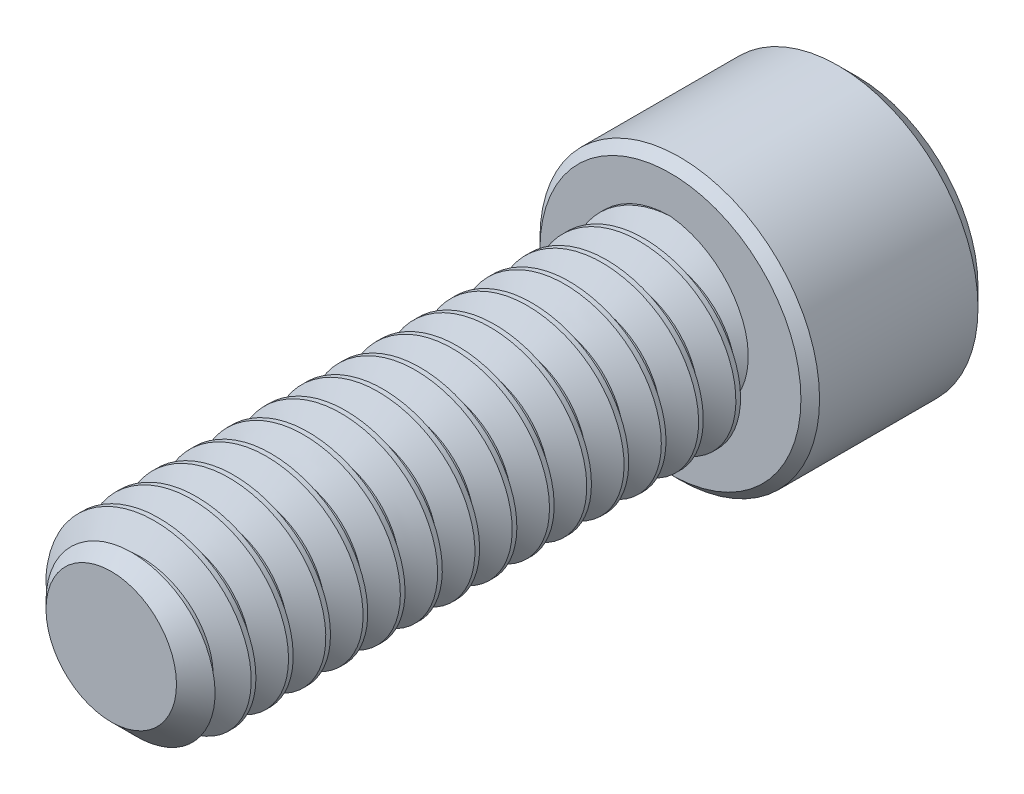
from build123d import *

# Parameters (mm, degrees)
SKETCH1_R          = 3.175
EXTRUDE1_DEPTH     = 19.05
CHAMFER3_SIZE      = 0.9525
CUT_SWEEP1_PITCH   = 1.27
SKETCH6_R          = 4.7625
EXTRUDE2_DEPTH     = 6.35
CUT_EXTRUDE1_DEPTH = 3.571875
SKETCH8_R          = 2.749630657
CUT_EXTRUDE2_DEPTH = 0.635
CUT_EXTRUDE2_DRAFT = -45
CHAMFER1_SIZE      = 0.635
CHAMFER2_SIZE      = 0.3175


with BuildPart() as part:
    # Sketch1 → Extrude1 (new body)
    with BuildSketch(Plane.XY):
        Circle(SKETCH1_R)
    extrude(amount=-EXTRUDE1_DEPTH)

    # Chamfer3
    chamfer3_edges = [part.edges().sort_by_distance(p)[0] for p in [
        (-3.175, 0, 0),
    ]]
    chamfer(chamfer3_edges, length=CHAMFER3_SIZE)

    # Cut-Sweep1: the profile of Sketch3 profile screwed along a right-hand helix of 16 turns, 6 arcs to a turn; built about Z, then put on its axis
    cut_sweep1_z = Axis((0, 0, 0), (0, 0, 1))
    cut_sweep1_corners = [(3.1753, 0, -1.111423205), (2.350110803, 0, -0.635), (2.350110803, 0, -0.47625), (3.1753, 0, 0.000173205)]
    with BuildLine(mode=Mode.PRIVATE) as cut_sweep1_profile:
        Line(cut_sweep1_corners[0], cut_sweep1_corners[1])
        Line(cut_sweep1_corners[1], cut_sweep1_corners[2])
        Line(cut_sweep1_corners[2], cut_sweep1_corners[3])
        Line(cut_sweep1_corners[3], cut_sweep1_corners[0])
    cut_sweep1_cap = Face(cut_sweep1_profile.wire())
    cut_sweep1_turn_angles = [0, 30, 60, 90, 120, 150, 180, 210, 240, 270, 300, 330, 360]
    cut_sweep1_turn_weights = [1, 0.8660254037844387, 1, 0.8660254037844387, 1, 0.8660254037844387, 1, 0.8660254037844387, 1, 0.8660254037844387, 1, 0.8660254037844387, 1]
    cut_sweep1_turn_rails = [Edge.make_bspline([Vector(p[0], p[1], 0).rotate(cut_sweep1_z, cut_sweep1_turn_angles[k]) / cut_sweep1_turn_weights[k] + Vector(0, 0, p[2] + CUT_SWEEP1_PITCH * cut_sweep1_turn_angles[k] / 360) for k in range(13)], [0, 0, 0, 1, 1, 2, 2, 3, 3, 4, 4, 5, 5, 6, 6, 6], 2, cut_sweep1_turn_weights) for p in cut_sweep1_corners]
    cut_sweep1_turn_sides = [Face.make_surface_from_curves(cut_sweep1_turn_rails[p[0]], cut_sweep1_turn_rails[p[1]]) for p in [(0, 1), (1, 2), (2, 3), (3, 0)]]
    cut_sweep1 = Plane(origin=(0, 0, 0), x_dir=(0, 1, 0), z_dir=(0, 0, -1)) * Solid(Shell([*[p.moved(Location((0, 0, CUT_SWEEP1_PITCH * i))) for i in range(16) for p in cut_sweep1_turn_sides], cut_sweep1_cap, cut_sweep1_cap.rotate(cut_sweep1_z, 5760).moved(Location((0, 0, CUT_SWEEP1_PITCH * 5760 / 360)))]))
    add(cut_sweep1, mode=Mode.SUBTRACT)

    # Sketch6 → Extrude2 (add)
    with BuildSketch(Plane(origin=(0, 0, -19.05), x_dir=(-1, 0, 0), z_dir=(0, 0, -1))):
        Circle(SKETCH6_R)
    extrude(amount=EXTRUDE2_DEPTH)

    # Sketch7 → Cut-Extrude1 (cut)
    with BuildSketch(Plane(origin=(0, 0, -25.4), x_dir=(-1, 0, 0), z_dir=(0, 0, -1))):
        Polygon((0, 2.749630657), (-2.38125, 1.374815329), (-2.38125, -1.374815329), (0, -2.749630657), (2.38125, -1.374815329), (2.38125, 1.374815329), align=None)
    extrude(amount=-CUT_EXTRUDE1_DEPTH, mode=Mode.SUBTRACT)


with BuildPart() as cut_extrude2_tool:
    # Sketch8 → Cut-Extrude2 (with draft: the straight prism first)
    with BuildSketch(Plane(origin=(0, 0, -25.4), x_dir=(-1, 0, 0), z_dir=(0, 0, -1))):
        Circle(SKETCH8_R)
    extrude(amount=-CUT_EXTRUDE2_DEPTH)
    # Cut-Extrude2: the draft: its side faces are tilted about the plane it starts from
    cut_extrude2_sides = [cut_extrude2_tool.faces().sort_by_distance(p)[0] for p in [
        (2.749630657, 0, -25.0825),
    ]]
    draft(cut_extrude2_sides, Plane(origin=(0, 0, -25.4), x_dir=(-1, 0, 0), z_dir=(0, 0, -1)), CUT_EXTRUDE2_DRAFT)


with BuildPart() as part_1:
    add(part.part)

    # Cut-Extrude2: cut by cut_extrude2_tool
    add(cut_extrude2_tool.part, mode=Mode.SUBTRACT)

    # Chamfer1
    chamfer1_edges = [part_1.edges().sort_by_distance(p)[0] for p in [
        (4.7625, 0, -25.4),
    ]]
    chamfer(chamfer1_edges, length=CHAMFER1_SIZE)

    # Chamfer2
    chamfer2_edges = [part_1.edges().sort_by_distance(p)[0] for p in [
        (4.7625, 0, -19.05),
    ]]
    chamfer(chamfer2_edges, length=CHAMFER2_SIZE)


solid = part_1.part
